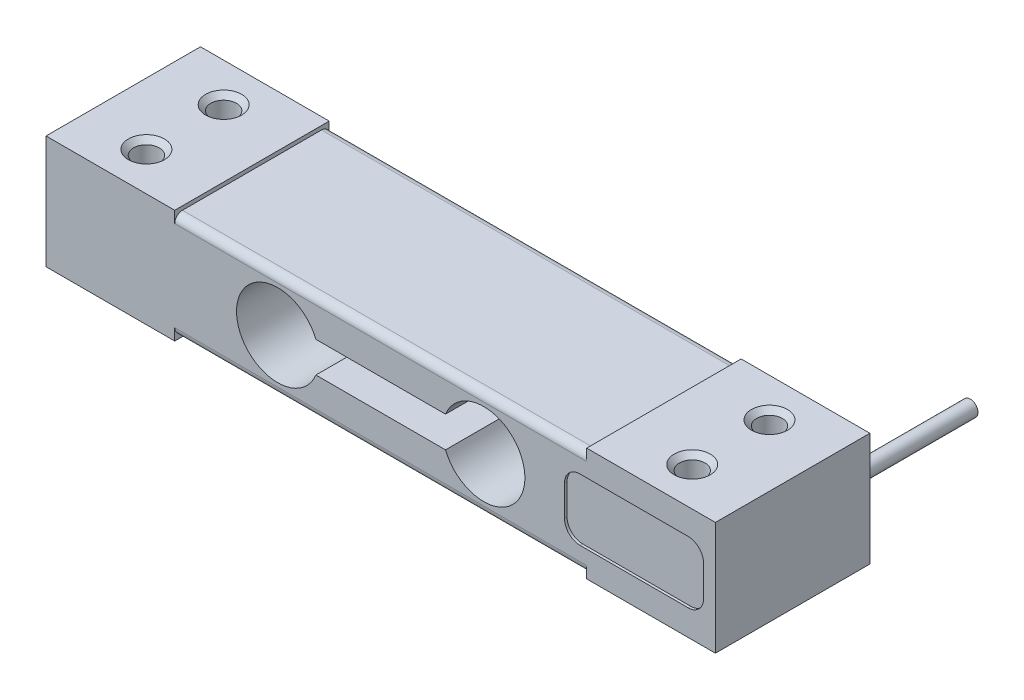
from build123d import *

# Parameters (mm, degrees)
EXTRUDE_1_DEPTH     = 15
HOLE_WIZARD_M6_1_D  = 5
CHAMFER_1_SIZE      = 1
SKETCH_4_W          = 80
SKETCH_4_H          = 1.5
EXTRUDE_2_DEPTH     = 30
EXTRUDE_2_2_DEPTH   = 30
FILLET_1_R          = 1.5
FILLET_2_R          = 1.5
CUT_EXTRUDE_1_DEPTH = 0.5
SKETCH_6_R          = 1.5
EXTRUDE_3_DEPTH     = 25


with BuildPart() as part:
    # 草图1 → 凸台-拉伸1 (new, symmetric)
    with BuildSketch(Plane.XY):
        Polygon((-40, 11), (-40, 8.75), (40, 8.75), (40, 11), (65, 11), (65, -11), (40, -11), (40, -8.75), (-40, -8.75), (-40, -11), (-65, -11), (-65, 11), align=None)
        with BuildLine():
            Line((-12.583801513, -3), (12.583801513, -3))
            ThreePointArc((12.583801513, -3), (28, 0), (12.583801513, 3))
            Line((12.583801513, 3), (-12.583801513, 3))
            ThreePointArc((-12.583801513, 3), (-28, 0), (-12.583801513, -3))
        make_face(mode=Mode.SUBTRACT)
    extrude(amount=EXTRUDE_1_DEPTH, both=True)

    # M6 螺纹孔1 (through all)
    with Locations(Plane(origin=(-53, 11, -7.5), x_dir=(0, 0, 1), z_dir=(0, 1, 0))):
        with Locations((0, 0), (15, 0), (0, 106), (15, 106)):
            Hole(HOLE_WIZARD_M6_1_D / 2)

    # 倒角1
    chamfer_1_edges = [part.edges().sort_by_distance(p)[0] for p in [
        (53, 11, 10),
        (53, -11, 10),
        (53, 11, -5),
        (53, -11, -5),
        (-53, 11, 10),
        (-53, -11, 10),
        (-53, 11, -5),
        (-53, -11, -5),
    ]]
    chamfer(chamfer_1_edges, length=CHAMFER_1_SIZE)

    # 草图5 → 切除-拉伸1 (cut)
    with BuildSketch(Plane.XY.offset(15)):
        with BuildLine():
            Line((38.7, 6), (59.7, 6))
            ThreePointArc((59.7, 6), (61.821320344, 5.121320344), (62.7, 3))
            Line((62.7, 3), (62.7, -3))
            ThreePointArc((62.7, -3), (61.821320344, -5.121320344), (59.7, -6))
            Line((59.7, -6), (38.7, -6))
            ThreePointArc((38.7, -6), (36.578679656, -5.121320344), (35.7, -3))
            Line((35.7, -3), (35.7, 3))
            ThreePointArc((35.7, 3), (36.578679656, 5.121320344), (38.7, 6))
        make_face()
    extrude(amount=-CUT_EXTRUDE_1_DEPTH, mode=Mode.SUBTRACT)

    # 草图6 → 凸台-拉伸3 (add)
    with BuildSketch(Plane(origin=(0, 0, -15), x_dir=(-1, 0, 0), z_dir=(0, 0, -1))):
        with Locations((-59.5, 0)):
            Circle(SKETCH_6_R)
    extrude(amount=EXTRUDE_3_DEPTH)


with BuildPart() as body_2:
    # 草图4 → 凸台-拉伸2 (new body)
    with BuildSketch(Plane.XY.offset(15)):
        with Locations((0, 9.5)):
            Rectangle(SKETCH_4_W, SKETCH_4_H)
    extrude(amount=-EXTRUDE_2_DEPTH)

    # 圆角1
    fillet_1_edges = [body_2.edges().sort_by_distance(p)[0] for p in [
        (0, 10.25, -15),
        (0, 10.25, 15),
    ]]
    fillet(fillet_1_edges, radius=FILLET_1_R - 0.0001)  # a hair under: the kernel refuses the full size


with BuildPart() as body_3:
    # 草图4 → Extrude 2 2 (new body)
    with BuildSketch(Plane.XY.offset(15)):
        with Locations((0, -9.5)):
            Rectangle(SKETCH_4_W, SKETCH_4_H)
    extrude(amount=-EXTRUDE_2_2_DEPTH)

    # 圆角2
    fillet_2_edges = [body_3.edges().sort_by_distance(p)[0] for p in [
        (0, -10.25, -15),
        (0, -10.25, 15),
    ]]
    fillet(fillet_2_edges, radius=FILLET_2_R - 0.0001)  # a hair under: the kernel refuses the full size


solid = Compound([part.part, body_2.part, body_3.part])
